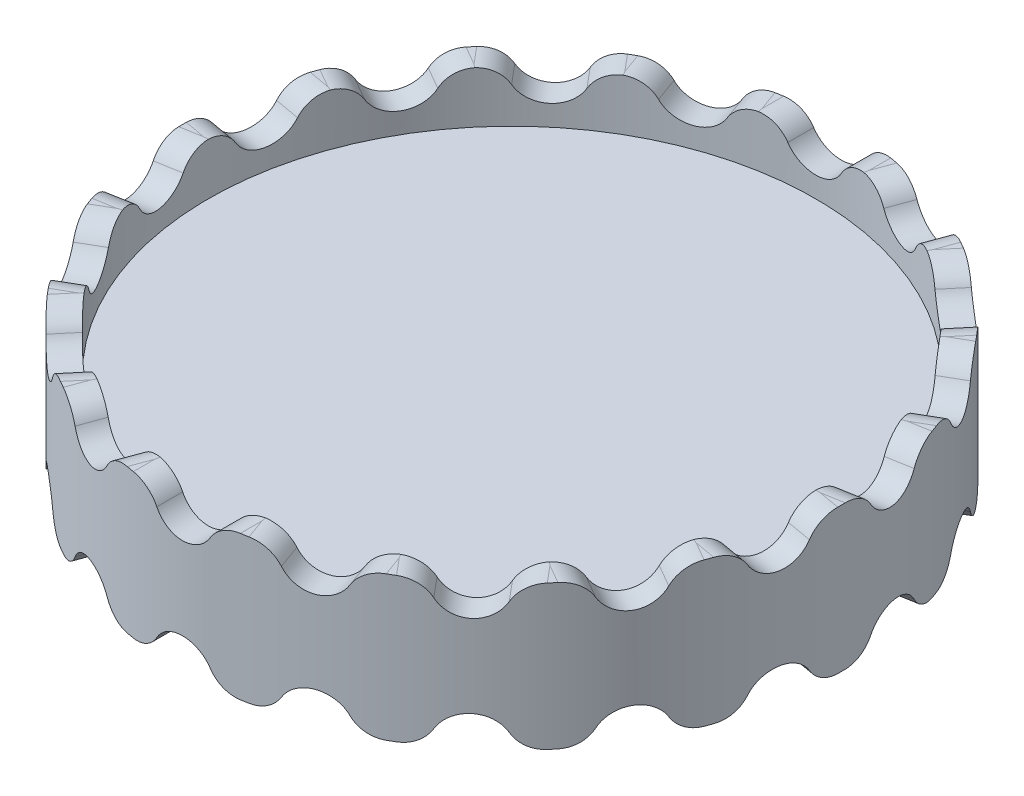
from build123d import *

# Parameters (mm, degrees)
SKETCH1_R                = 16
BOSS_EXTRUDE1_DEPTH      = 7
SKETCH4_R                = 14.75
CUT_EXTRUDE1_DEPTH       = 2.5
CUT_EXTRUDE2_REACH       = 38.455
CUT_EXTRUDE2_END_RADIUS  = 14.75
FILLET1_R                = 1.5
CIRPATTERN1_COUNT        = 18
FILLET1_OF_CIRPATTERN1_R = 1.5


with BuildPart() as part:
    # Sketch1 → Boss-Extrude1 (new body)
    with BuildSketch(Plane(origin=(0, 0, 0), x_dir=(1, 0, 0), z_dir=(0, 1, 0))):
        with Locations(Location((0, 0, 0), (0, 0, 270))):
            Circle(SKETCH1_R)
    extrude(amount=BOSS_EXTRUDE1_DEPTH)

    # Sketch4 → Cut-Extrude1 (cut)
    with BuildSketch(Plane(origin=(0, 7, 0), x_dir=(1, 0, 0), z_dir=(0, 1, 0))):
        with Locations(Location((0, 0, 0), (0, 0, 270))):
            Circle(SKETCH4_R)
    cut_extrude1 = extrude(amount=-CUT_EXTRUDE1_DEPTH, mode=Mode.SUBTRACT)

    # Mirror1: Cut-Extrude1 across plane
    add(cut_extrude1.mirror(Plane.ZX.offset(3.5)), mode=Mode.SUBTRACT)

    # Cut-Extrude2: up to this cylinder (the profile starts outside it)
    cut_extrude2_end = Plane(origin=(0, 3.5, 0), z_dir=(0, 1, 0)) * Cylinder(CUT_EXTRUDE2_END_RADIUS, 113.13676, mode=Mode.PRIVATE)
    # Sketch3 → Cut-Extrude2 (cut, up to the surface)
    with BuildSketch(Plane(origin=(0, 7, 16), x_dir=(1, 0, 0), z_dir=(0, 0, 1)), mode=Mode.PRIVATE) as cut_extrude2_sk1:
        with BuildLine():
            Line((1.5, -7), (-1.5, -7))
            ThreePointArc((-1.5, -7), (0, -5.5), (1.5, -7))
        make_face()
    cut_extrude2_tool1 = extrude(cut_extrude2_sk1.sketch, amount=-CUT_EXTRUDE2_REACH, mode=Mode.PRIVATE) - cut_extrude2_end
    # Sketch3 → Cut-Extrude2 (cut, up to the surface)
    with BuildSketch(Plane(origin=(0, 7, 16), x_dir=(1, 0, 0), z_dir=(0, 0, 1)), mode=Mode.PRIVATE) as cut_extrude2_sk2:
        with BuildLine():
            Line((-1.5, 0), (1.5, 0))
            ThreePointArc((1.5, 0), (0, -1.5), (-1.5, 0))
        make_face()
    cut_extrude2_tool2 = extrude(cut_extrude2_sk2.sketch, amount=-CUT_EXTRUDE2_REACH, mode=Mode.PRIVATE) - cut_extrude2_end
    cut_extrude2 = cut_extrude2_tool1.solids().sort_by_distance((0, 0.63662, 16))[0] + cut_extrude2_tool2.solids().sort_by_distance((0, 6.36338, 16))[0]
    add(cut_extrude2, mode=Mode.SUBTRACT)

    # Fillet1
    # the kernel refuses this fillet: 1.5 mm, written as the material it takes off along each edge
    with BuildSketch(Plane(origin=(-1.5, 7, 18.67472285), x_dir=(0.25881904510252046, -0.9659258262890684, 0), z_dir=(0, 0, -1)), Plane(origin=(1.5, 0, 18.67472285), x_dir=(-0.25881904510251996, 0.9659258262890684, 0), z_dir=(0, 0, -1))) as fillet1_piece_1:
        with BuildLine():
            CenterArc((1.164685703, 1.448888739), FILLET1_R, 195, 60)
            Line((-0.284203036, 1.060660172), (0, 0))
            ThreePointArc((0, 0), (0.388228568, 0.051111261), (0.776457135, 0))
        make_face()
    extrude(amount=6.746382788, mode=Mode.SUBTRACT)
    with BuildSketch(Plane(origin=(1.5, 7, 18.67472285), x_dir=(-0.25881904510252096, -0.9659258262890682, 0), z_dir=(0, 0, -1)), Plane(origin=(-1.5, 0, 18.67472285), x_dir=(0.2588190451025204, 0.9659258262890684, 0), z_dir=(0, 0, -1))) as fillet1_piece_2:
        with BuildLine():
            CenterArc((1.164685703, -1.448888739), FILLET1_R, 105, 60)
            Line((-0.284203036, -1.060660172), (0, 0))
            ThreePointArc((0, 0), (0.388228568, -0.051111261), (0.776457135, 0))
        make_face()
    extrude(amount=6.746382788, mode=Mode.SUBTRACT)

    # CirPattern1: Cut-Extrude2 ×18 about axis
    cirpattern1_axis = Axis((0, 7, 0), (0, -1, 0))
    for i in range(1, CIRPATTERN1_COUNT):
        add(cut_extrude2.rotate(cirpattern1_axis, i * 360 / CIRPATTERN1_COUNT), mode=Mode.SUBTRACT)

    # Fillet1 of CirPattern1
    # the kernel refuses this fillet: 1.5 mm, written as the material it takes off along each edge
    with BuildSketch(Plane(origin=(-7.796670317, 7, 17.035469043), x_dir=(0.24321034680169434, -0.9659258262890682, 0.088521326901377), z_dir=(0.3420201433256687, 0, -0.9396926207859084)), Plane(origin=(-4.977592455, 0, 18.061529473), x_dir=(-0.24321034680169396, 0.9659258262890682, -0.08852132690137686), z_dir=(0.3420201433256687, 0, -0.9396926207859084)), Plane(origin=(-13.152947127, 7, 13.341486252), x_dir=(0.198266891274147, -0.965925826289068, 0.16636567534280264), z_dir=(0.6427876096865394, 0, -0.7660444431189781)), Plane(origin=(-10.854813798, 0, 15.269849081), x_dir=(-0.1982668912741446, 0.9659258262890688, -0.1663656753428006), z_dir=(0.6427876096865394, 0, -0.7660444431189781)), Plane(origin=(-16.922784397, 7, 8.03832332), x_dir=(0.12940952255126134, -0.9659258262890676, 0.22414386804201497), z_dir=(0.8660254037844386, 0, -0.5000000000000001)), Plane(origin=(-15.422784397, 0, 10.636399531), x_dir=(-0.12940952255125984, 0.9659258262890686, -0.2241438680420124), z_dir=(0.8660254037844386, 0, -0.5000000000000001)), Plane(origin=(-18.651484115, 7, 1.765619962), x_dir=(0.04494345552754771, -0.9659258262890684, 0.2548870022441782), z_dir=(0.9848077530122081, 0, -0.17364817766693044)), Plane(origin=(-18.130539582, 0, 4.720043221), x_dir=(-0.04494345552754772, 0.9659258262890684, -0.2548870022441783), z_dir=(0.9848077530122081, 0, -0.17364817766693044)), Plane(origin=(-18.130539582, 7, -4.720043221), x_dir=(-0.04494345552754773, -0.9659258262890684, 0.2548870022441785), z_dir=(0.9848077530122081, 0, 0.17364817766693033)), Plane(origin=(-18.651484115, 0, -1.765619962), x_dir=(0.04494345552754765, 0.9659258262890684, -0.25488700224417804), z_dir=(0.9848077530122081, 0, 0.17364817766693033)), Plane(origin=(-15.422784397, 7, -10.636399531), x_dir=(-0.12940952255126034, -0.9659258262890682, 0.22414386804201342), z_dir=(0.8660254037844388, 0, 0.49999999999999983)), Plane(origin=(-16.922784397, 0, -8.03832332), x_dir=(0.1294095225512603, 0.9659258262890682, -0.2241438680420133), z_dir=(0.8660254037844388, 0, 0.49999999999999983)), Plane(origin=(-10.854813798, 7, -15.269849081), x_dir=(-0.19826689127414576, -0.9659258262890685, 0.16636567534280164), z_dir=(0.6427876096865395, 0, 0.7660444431189779)), Plane(origin=(-13.152947127, 0, -13.341486252), x_dir=(0.19826689127414687, 0.9659258262890681, -0.16636567534280258), z_dir=(0.6427876096865395, 0, 0.7660444431189779)), Plane(origin=(-4.977592455, 7, -18.061529473), x_dir=(-0.24321034680169407, -0.9659258262890682, 0.08852132690137693), z_dir=(0.3420201433256689, 0, 0.9396926207859084)), Plane(origin=(-7.796670317, 0, -17.035469043), x_dir=(0.24321034680169257, 0.9659258262890686, -0.08852132690137639), z_dir=(0.3420201433256689, 0, 0.9396926207859084)), Plane(origin=(1.5, 7, -18.67472285), x_dir=(-0.25881904510252046, -0.9659258262890684, 0), z_dir=(0, 0, 1)), Plane(origin=(-1.5, 0, -18.67472285), x_dir=(0.2588190451025201, 0.9659258262890685, 0), z_dir=(0, 0, 1)), Plane(origin=(7.796670317, 7, -17.035469043), x_dir=(-0.2432103468016927, -0.9659258262890686, -0.08852132690137637), z_dir=(-0.34202014332566866, 0, 0.9396926207859084)), Plane(origin=(4.977592455, 0, -18.061529473), x_dir=(0.24321034680169396, 0.9659258262890682, 0.08852132690137683), z_dir=(-0.34202014332566866, 0, 0.9396926207859084)), Plane(origin=(13.152947127, 7, -13.341486252), x_dir=(-0.1982668912741447, -0.9659258262890688, -0.1663656753428007), z_dir=(-0.6427876096865394, 0, 0.7660444431189781)), Plane(origin=(10.854813798, 0, -15.269849081), x_dir=(0.1982668912741446, 0.9659258262890688, 0.1663656753428006), z_dir=(-0.6427876096865394, 0, 0.7660444431189781)), Plane(origin=(16.922784397, 7, -8.03832332), x_dir=(-0.12940952255126048, -0.9659258262890682, -0.22414386804201333), z_dir=(-0.8660254037844384, 0, 0.5000000000000004)), Plane(origin=(15.422784397, 0, -10.636399531), x_dir=(0.12940952255125954, 0.9659258262890688, 0.22414386804201167), z_dir=(-0.8660254037844384, 0, 0.5000000000000004)), Plane(origin=(18.651484115, 7, -1.765619962), x_dir=(-0.04494345552754776, -0.9659258262890682, -0.2548870022441787), z_dir=(-0.9848077530122081, 0, 0.17364817766693033)), Plane(origin=(18.130539582, 0, -4.720043221), x_dir=(0.0449434555275477, 0.9659258262890684, 0.2548870022441783), z_dir=(-0.9848077530122081, 0, 0.17364817766693033)), Plane(origin=(18.130539582, 7, 4.720043221), x_dir=(0.04494345552754764, -0.9659258262890684, -0.25488700224417854), z_dir=(-0.9848077530122081, 0, -0.17364817766692997)), Plane(origin=(18.651484115, 0, 1.765619962), x_dir=(-0.04494345552754775, 0.9659258262890681, 0.25488700224417915), z_dir=(-0.9848077530122081, 0, -0.17364817766692997)), Plane(origin=(15.422784397, 7, 10.636399531), x_dir=(0.12940952255126043, -0.9659258262890682, -0.2241438680420134), z_dir=(-0.8660254037844386, 0, -0.5000000000000001)), Plane(origin=(16.922784397, 0, 8.03832332), x_dir=(-0.12940952255126037, 0.9659258262890682, 0.22414386804201328), z_dir=(-0.8660254037844386, 0, -0.5000000000000001)), Plane(origin=(10.854813798, 7, 15.269849081), x_dir=(0.1982668912741457, -0.9659258262890685, -0.16636567534280164), z_dir=(-0.6427876096865396, 0, -0.7660444431189778)), Plane(origin=(13.152947127, 0, 13.341486252), x_dir=(-0.19826689127414662, 0.9659258262890681, 0.16636567534280244), z_dir=(-0.6427876096865396, 0, -0.7660444431189778)), Plane(origin=(4.977592455, 7, 18.061529473), x_dir=(0.24321034680169315, -0.9659258262890685, -0.08852132690137654), z_dir=(-0.3420201433256686, 0, -0.9396926207859084)), Plane(origin=(7.796670317, 0, 17.035469043), x_dir=(-0.24321034680169396, 0.9659258262890682, 0.08852132690137683), z_dir=(-0.3420201433256686, 0, -0.9396926207859084))) as fillet1_of_cirpattern1_piece_1:
        with BuildLine():
            CenterArc((1.164685703, 1.448888739), FILLET1_OF_CIRPATTERN1_R, 195, 60)
            Line((-0.284203036, 1.060660172), (0, 0))
            ThreePointArc((0, 0), (0.388228568, 0.051111261), (0.776457135, 0))
        make_face()
    extrude(amount=6.746382788, mode=Mode.SUBTRACT)
    with BuildSketch(Plane(origin=(-4.977592455, 7, 18.061529473), x_dir=(0.9396926207859083, 0, 0.3420201433256687), z_dir=(0.3420201433256687, 0, -0.9396926207859084)), Plane(origin=(-7.796670317, 0, 17.035469043), x_dir=(-0.9396926207859084, 0, -0.34202014332566877), z_dir=(0.3420201433256687, 0, -0.9396926207859084)), Plane(origin=(-10.854813798, 7, 15.269849081), x_dir=(0.7660444431189781, 0, 0.6427876096865394), z_dir=(0.6427876096865394, 0, -0.7660444431189781)), Plane(origin=(-13.152947127, 0, 13.341486252), x_dir=(-0.766044443118978, 0, -0.6427876096865393), z_dir=(0.6427876096865394, 0, -0.7660444431189781)), Plane(origin=(-15.422784397, 7, 10.636399531), x_dir=(0.5000000000000001, 0, 0.8660254037844386), z_dir=(0.8660254037844386, 0, -0.5000000000000001)), Plane(origin=(-16.922784397, 0, 8.03832332), x_dir=(-0.5000000000000001, 0, -0.8660254037844386), z_dir=(0.8660254037844386, 0, -0.5000000000000001)), Plane(origin=(-18.130539582, 7, 4.720043221), x_dir=(0.17364817766693041, 0, 0.984807753012208), z_dir=(0.9848077530122081, 0, -0.17364817766693044)), Plane(origin=(-18.651484115, 0, 1.765619962), x_dir=(-0.17364817766693041, 0, -0.984807753012208), z_dir=(0.9848077530122081, 0, -0.17364817766693044)), Plane(origin=(-18.651484115, 7, -1.765619962), x_dir=(-0.1736481776669303, 0, 0.984807753012208), z_dir=(0.9848077530122081, 0, 0.17364817766693033)), Plane(origin=(-18.130539582, 0, -4.720043221), x_dir=(0.1736481776669303, 0, -0.984807753012208), z_dir=(0.9848077530122081, 0, 0.17364817766693033)), Plane(origin=(-16.922784397, 7, -8.03832332), x_dir=(-0.4999999999999998, 0, 0.8660254037844388), z_dir=(0.8660254037844388, 0, 0.49999999999999983)), Plane(origin=(-15.422784397, 0, -10.636399531), x_dir=(0.4999999999999998, 0, -0.8660254037844388), z_dir=(0.8660254037844388, 0, 0.49999999999999983)), Plane(origin=(-13.152947127, 7, -13.341486252), x_dir=(-0.7660444431189779, 0, 0.6427876096865395), z_dir=(0.6427876096865395, 0, 0.7660444431189779)), Plane(origin=(-10.854813798, 0, -15.269849081), x_dir=(0.7660444431189779, 0, -0.6427876096865395), z_dir=(0.6427876096865395, 0, 0.7660444431189779)), Plane(origin=(-7.796670317, 7, -17.035469043), x_dir=(-0.9396926207859083, 0, 0.3420201433256688), z_dir=(0.3420201433256689, 0, 0.9396926207859084)), Plane(origin=(-4.977592455, 0, -18.061529473), x_dir=(0.9396926207859084, 0, -0.3420201433256689), z_dir=(0.3420201433256689, 0, 0.9396926207859084)), Plane(origin=(-1.5, 7, -18.67472285), x_dir=(-1, 0, 0), z_dir=(0, 0, 1)), Plane(origin=(1.5, 0, -18.67472285), x_dir=(1, 0, 0), z_dir=(0, 0, 1)), Plane(origin=(4.977592455, 7, -18.061529473), x_dir=(-0.9396926207859084, 0, -0.34202014332566866), z_dir=(-0.34202014332566866, 0, 0.9396926207859084)), Plane(origin=(7.796670317, 0, -17.035469043), x_dir=(0.9396926207859084, 0, 0.34202014332566866), z_dir=(-0.34202014332566866, 0, 0.9396926207859084)), Plane(origin=(10.854813798, 7, -15.269849081), x_dir=(-0.7660444431189781, 0, -0.6427876096865394), z_dir=(-0.6427876096865394, 0, 0.7660444431189781)), Plane(origin=(13.152947127, 0, -13.341486252), x_dir=(0.7660444431189781, 0, 0.6427876096865394), z_dir=(-0.6427876096865394, 0, 0.7660444431189781)), Plane(origin=(15.422784397, 7, -10.636399531), x_dir=(-0.5000000000000004, 0, -0.8660254037844384), z_dir=(-0.8660254037844384, 0, 0.5000000000000004)), Plane(origin=(16.922784397, 0, -8.03832332), x_dir=(0.5000000000000004, 0, 0.8660254037844385), z_dir=(-0.8660254037844384, 0, 0.5000000000000004)), Plane(origin=(18.130539582, 7, -4.720043221), x_dir=(-0.1736481776669303, 0, -0.984807753012208), z_dir=(-0.9848077530122081, 0, 0.17364817766693033)), Plane(origin=(18.651484115, 0, -1.765619962), x_dir=(0.17364817766693033, 0, 0.984807753012208), z_dir=(-0.9848077530122081, 0, 0.17364817766693033)), Plane(origin=(18.651484115, 7, 1.765619962), x_dir=(0.17364817766693, 0, -0.9848077530122081), z_dir=(-0.9848077530122081, 0, -0.17364817766692997)), Plane(origin=(18.130539582, 0, 4.720043221), x_dir=(-0.17364817766693, 0, 0.9848077530122082), z_dir=(-0.9848077530122081, 0, -0.17364817766692997)), Plane(origin=(16.922784397, 7, 8.03832332), x_dir=(0.5000000000000001, 0, -0.8660254037844386), z_dir=(-0.8660254037844386, 0, -0.5000000000000001)), Plane(origin=(15.422784397, 0, 10.636399531), x_dir=(-0.5000000000000001, 0, 0.8660254037844386), z_dir=(-0.8660254037844386, 0, -0.5000000000000001)), Plane(origin=(13.152947127, 7, 13.341486252), x_dir=(0.7660444431189778, 0, -0.6427876096865397), z_dir=(-0.6427876096865396, 0, -0.7660444431189778)), Plane(origin=(10.854813798, 0, 15.269849081), x_dir=(-0.7660444431189778, 0, 0.6427876096865397), z_dir=(-0.6427876096865396, 0, -0.7660444431189778)), Plane(origin=(7.796670317, 7, 17.035469043), x_dir=(0.9396926207859084, 0, -0.3420201433256686), z_dir=(-0.3420201433256686, 0, -0.9396926207859084)), Plane(origin=(4.977592455, 0, 18.061529473), x_dir=(-0.9396926207859083, 0, 0.3420201433256686), z_dir=(-0.3420201433256686, 0, -0.9396926207859084))) as fillet1_of_cirpattern1_piece_2:
        with BuildLine():
            CenterArc((1.098076211, 1.5), FILLET1_OF_CIRPATTERN1_R, 210, 60)
            ThreePointArc((-0.200961894, 0.75), (-0.051111261, 0.388228568), (0, 0))
            Line((0, 0), (1.098076211, 0))
        make_face()
    extrude(amount=6.746382788, mode=Mode.SUBTRACT)


solid = part.part
